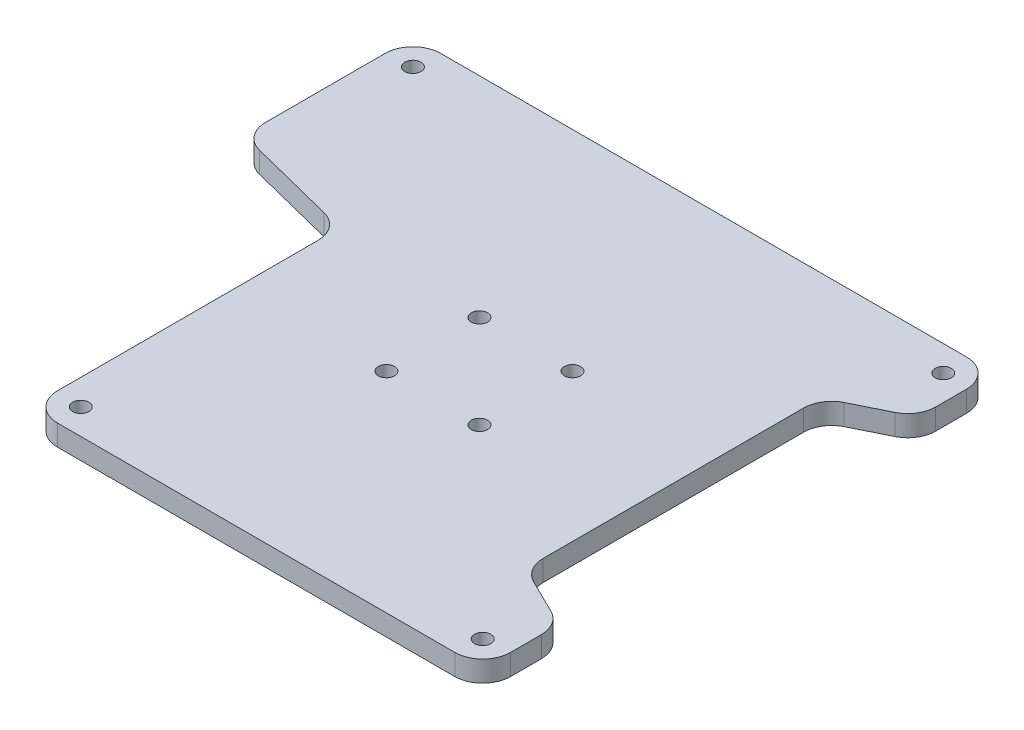
from build123d import *

# Parameters (mm, degrees)
SKETCH1_R           = 1.75
BOSS_EXTRUDE1_DEPTH = 4.5


with BuildPart() as part:
    # Sketch1 → Boss-Extrude1 (new body)
    with BuildSketch(Plane(origin=(0, 0, 0), x_dir=(1, 0, 0), z_dir=(0, 1, 0))):
        with BuildLine():
            Line((-35.7, -55), (49.7, -55))
            ThreePointArc((49.7, -55), (53.942640687, -53.242640687), (55.7, -49))
            Line((55.7, -49), (55.7, -42.377818725))
            ThreePointArc((55.7, -42.377818725), (54.797249664, -39.212689049), (52.36065138, -37))
            Line((52.36065138, -37), (45.03934862, -33.377818725))
            ThreePointArc((45.03934862, -33.377818725), (42.602750336, -31.165129675), (41.7, -28))
            Line((41.7, -28), (41.7, 28))
            ThreePointArc((41.7, 28), (42.602750336, 31.165129675), (45.03934862, 33.377818725))
            Line((45.03934862, 33.377818725), (52.36065138, 37))
            ThreePointArc((52.36065138, 37), (54.797249664, 39.212689049), (55.7, 42.377818725))
            Line((55.7, 42.377818725), (55.7, 49))
            ThreePointArc((55.7, 49), (53.942640687, 53.242640687), (49.7, 55))
            Line((49.7, 55), (-63.3, 55))
            ThreePointArc((-63.3, 55), (-67.542640687, 53.242640687), (-69.3, 49))
            Line((-69.3, 49), (-69.3, 23.31729281))
            ThreePointArc((-69.3, 23.31729281), (-68.03372658, 19.630582533), (-64.769389112, 17.5))
            Line((-64.769389112, 17.5), (-46.230610888, 12.81729281))
            ThreePointArc((-46.230610888, 12.81729281), (-42.96627342, 10.686710277), (-41.7, 7))
            Line((-41.7, 7), (-41.7, -49))
            ThreePointArc((-41.7, -49), (-39.942640687, -53.242640687), (-35.7, -55))
        make_face()
        with Locations((-63.8, 49.5)):
            Circle(SKETCH1_R, mode=Mode.SUBTRACT)
        with Locations((-36.2, -49.5)):
            Circle(SKETCH1_R, mode=Mode.SUBTRACT)
        with Locations((50.2, -49.5)):
            Circle(SKETCH1_R, mode=Mode.SUBTRACT)
        with Locations((50.2, 49.5)):
            Circle(SKETCH1_R, mode=Mode.SUBTRACT)
        with Locations((-10, 10)):
            Circle(SKETCH1_R, mode=Mode.SUBTRACT)
        with Locations((-10, -10)):
            Circle(SKETCH1_R, mode=Mode.SUBTRACT)
        with Locations((10, -10)):
            Circle(SKETCH1_R, mode=Mode.SUBTRACT)
        with Locations((10, 10)):
            Circle(SKETCH1_R, mode=Mode.SUBTRACT)
    extrude(amount=BOSS_EXTRUDE1_DEPTH)


solid = part.part
